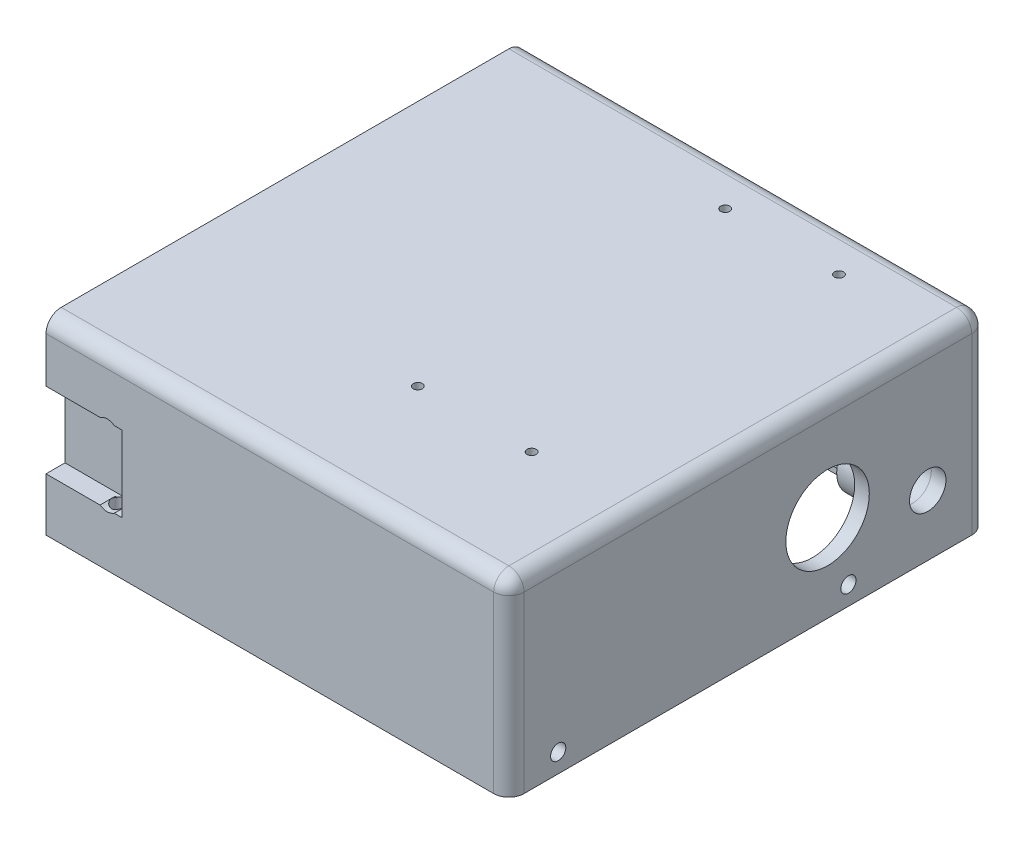
from build123d import *

# Parameters (mm, degrees)
SKETCH1_W                     = 63
SKETCH1_H                     = 63
BOSS_EXTRUDE2_DEPTH           = 25
SKETCH1_4_W                   = 59
SKETCH1_4_H                   = 55
CUT_EXTRUDE1_DEPTH            = 23
SKETCH4_W                     = 2
SKETCH4_H                     = 55
BOSS_EXTRUDE3_DEPTH           = 10
FILLET1_R                     = 2
SKETCH5_W                     = 2
SKETCH5_H                     = 63
CUT_EXTRUDE3_DEPTH            = 93.536479293
SKETCH6_W                     = 2.2
SKETCH6_H                     = 2.2
CUT_EXTRUDE4_DEPTH            = 59
SKETCH7_W                     = 10
SKETCH7_H                     = 10
CUT_EXTRUDE5_DEPTH            = 2.5
CUT_EXTRUDE6_DEPTH            = 11.5
CUT_EXTRUDE6_DEPTH_BACK       = 1.5
SKETCH8_R                     = 0.875
SKETCH9_W                     = 10
SKETCH9_H                     = 10
CUT_EXTRUDE7_DEPTH            = 2.5
CUT_EXTRUDE8_DEPTH            = 11.5
CUT_EXTRUDE8_DEPTH_BACK       = 1.5
SKETCH10_R                    = 0.875
CUT_EXTRUDE9_DEPTH            = 2
CUT_EXTRUDE10_DEPTH           = 2
FILLET2_R                     = 0.3
CUT_EXTRUDE12_REACH           = 94.536
CUT_EXTRUDE13_REACH           = 77.606
SKETCH15_W                    = 5
SKETCH15_H                    = 10
FILLET3_R                     = 1
SKETCH18_R                    = 2.4
CUT_EXTRUDE16_DEPTH           = 10
CUT_EXTRUDE16_DRAFT           = 2
SKETCH18_R_2                  = 5.5
CUT_EXTRUDE16_PROFILE_2_DEPTH = 10
CUT_EXTRUDE16_PROFILE_2_DRAFT = 2
SKETCH18_R_3                  = 1
CUT_EXTRUDE16_PROFILE_3_DEPTH = 10
CUT_EXTRUDE16_PROFILE_3_DRAFT = 2
CUT_EXTRUDE16_PROFILE_4_DEPTH = 10
CUT_EXTRUDE16_PROFILE_4_DRAFT = 2
SKETCH19_R                    = 2.469841539
BOSS_EXTRUDE4_DEPTH           = 6
SKETCH13_R                    = 0.6
CUT_EXTRUDE17_DEPTH           = 6


with BuildPart() as part:
    # Sketch1 → Boss-Extrude2 (new body)
    with BuildSketch(Plane(origin=(0, 0, 0), x_dir=(1, 0, 0), z_dir=(0, 1, 0))):
        with Locations((31.5, 31.5)):
            Rectangle(SKETCH1_W, SKETCH1_H)
    extrude(amount=BOSS_EXTRUDE2_DEPTH)

    # Sketch1<4> → Cut-Extrude1 (cut)
    with BuildSketch(Plane(origin=(0, 0, 0), x_dir=(1, 0, 0), z_dir=(0, 1, 0))):
        with Locations((31.5, 31.5)):
            Rectangle(SKETCH1_4_W, SKETCH1_4_H)
    extrude(amount=CUT_EXTRUDE1_DEPTH, mode=Mode.SUBTRACT)

    # Sketch4 → Boss-Extrude3 (add)
    with BuildSketch(Plane.XZ.offset(-23)):
        with Locations((30.5, -31.5)):
            Rectangle(SKETCH4_W, SKETCH4_H)
    extrude(amount=BOSS_EXTRUDE3_DEPTH)

    # Fillet1
    fillet1_edges = [part.edges().sort_by_distance(p)[0] for p in [
        (63, 25, -31.5),
        (31.5, 25, 0),
        (0, 25, -31.5),
        (0, 12.5, 0),
        (63, 12.5, 0),
        (63, 12.5, -63),
        (0, 12.5, -63),
        (31.5, 25, -63),
    ]]
    fillet(fillet1_edges, radius=FILLET1_R)

    # Sketch5 → Cut-Extrude3 (cut, through all)
    with BuildSketch(Plane(origin=(0, 0, 0), x_dir=(-1, 0, 0), z_dir=(0, -1, 0))):
        with Locations((-1, 31.5)):
            Rectangle(SKETCH5_W, SKETCH5_H)
    extrude(amount=-CUT_EXTRUDE3_DEPTH, mode=Mode.SUBTRACT)

    # Sketch6 → Cut-Extrude4 (cut)
    with BuildSketch(Plane.ZY.offset(-2)):
        with Locations((-2.9, 1.85)):
            Rectangle(SKETCH6_W, SKETCH6_H)
        with Locations((-60.1, 1.85)):
            Rectangle(SKETCH6_W, SKETCH6_H)
    extrude(amount=-CUT_EXTRUDE4_DEPTH, mode=Mode.SUBTRACT)

    # Sketch7 → Cut-Extrude5 (cut)
    with BuildSketch(Plane(origin=(0, 0, -63), x_dir=(-1, 0, 0), z_dir=(0, 0, -1))):
        with Locations((-7, 12)):
            Rectangle(SKETCH7_W, SKETCH7_H)
    extrude(amount=-CUT_EXTRUDE5_DEPTH, mode=Mode.SUBTRACT)

    # Sketch8 → Cut-Extrude6 (cut, two sides: drawn at the far end of the back side and taken through both)
    with BuildSketch(Plane(origin=(0, 7, 0), x_dir=(1, 0, 0), z_dir=(0, 1, 0)).offset(-CUT_EXTRUDE6_DEPTH_BACK)):
        with Locations(Location((10, 61.5, 0), (0, 0, 270))):
            Circle(SKETCH8_R)
    extrude(amount=CUT_EXTRUDE6_DEPTH + CUT_EXTRUDE6_DEPTH_BACK, mode=Mode.SUBTRACT)

    # Sketch9 → Cut-Extrude7 (cut)
    with BuildSketch(Plane.XY):
        with Locations((7, 12)):
            Rectangle(SKETCH9_W, SKETCH9_H)
    extrude(amount=-CUT_EXTRUDE7_DEPTH, mode=Mode.SUBTRACT)

    # Sketch10 → Cut-Extrude8 (cut, two sides: drawn at the far end of the back side and taken through both)
    with BuildSketch(Plane(origin=(0, 7, 0), x_dir=(1, 0, 0), z_dir=(0, 1, 0)).offset(-CUT_EXTRUDE8_DEPTH_BACK)):
        with Locations((10, 1.5)):
            Circle(SKETCH10_R)
    extrude(amount=CUT_EXTRUDE8_DEPTH + CUT_EXTRUDE8_DEPTH_BACK, mode=Mode.SUBTRACT)

    # Sketch11 → Cut-Extrude9 (cut)
    with BuildSketch(Plane(origin=(0, 0, -63), x_dir=(-1, 0, 0), z_dir=(0, 0, -1))):
        with BuildLine():
            Line((-9.122986176, 7), (-10.8, 7))
            add(Edge.make_bspline(
                [(-10.8, 7), (-9.980201359, 6.395551325), (-9.122986176, 7)],
                knots=[0, 0, 0, 1, 1, 1], degree=2))
        make_face()
        with BuildLine():
            Line((-9.122986176, 17), (-10.8, 17))
            add(Edge.make_bspline(
                [(-10.8, 17), (-9.980201359, 17.604448675), (-9.122986176, 17)],
                knots=[0, 0, 0, 1, 1, 1], degree=2))
        make_face()
    extrude(amount=-CUT_EXTRUDE9_DEPTH, mode=Mode.SUBTRACT)

    # Sketch12 → Cut-Extrude10 (cut)
    with BuildSketch(Plane.XY):
        with BuildLine():
            Line((11, 7), (9.120131213, 7))
            add(Edge.make_bspline(
                [(11, 7), (10.05659536, 6.399803182), (9.120131213, 7)],
                knots=[0, 0, 0, 1, 1, 1], degree=2))
        make_face()
        with BuildLine():
            Line((11, 17), (9.120131213, 17))
            add(Edge.make_bspline(
                [(11, 17), (10.05659536, 17.600196818), (9.120131213, 17)],
                knots=[0, 0, 0, 1, 1, 1], degree=2))
        make_face()
    extrude(amount=-CUT_EXTRUDE10_DEPTH, mode=Mode.SUBTRACT)

    # Fillet2
    fillet2_edges = [part.edges().sort_by_distance(p)[0] for p in [
        (31.5, 2.95, -59),
        (2, 0.75, -60.1),
        (2, 1.85, -61.2),
        (31.5, 0.75, -61.2),
        (31.5, 2.95, -61.2),
        (2, 2.95, -60.1),
        (2, 2.95, -2.9),
        (31.5, 2.95, -4),
        (31.5, 2.95, -1.8),
        (31.5, 0.75, -1.8),
        (2, 0.75, -2.9),
        (2, 1.85, -1.8),
    ]]
    fillet(fillet2_edges, radius=FILLET2_R)

    # Sketch14 → Cut-Extrude12 (cut, up to next)
    with BuildSketch(Plane(origin=(0, 0, -63), x_dir=(-1, 0, 0), z_dir=(0, 0, -1)), mode=Mode.PRIVATE) as cut_extrude12_sk1:
        with BuildLine():
            Line((-39, 14.7), (-45, 14.7))
            ThreePointArc((-45, 14.7), (-48.25, 17.95), (-45, 21.2))
            Line((-45, 21.2), (-39, 21.2))
            ThreePointArc((-39, 21.2), (-35.75, 17.95), (-39, 14.7))
        make_face()
    cut_extrude12_tool1 = extrude(cut_extrude12_sk1.sketch, amount=-CUT_EXTRUDE12_REACH, mode=Mode.PRIVATE) & part.part
    add(cut_extrude12_tool1.solids().sort_by_distance((42, 17.95, -63))[0], mode=Mode.SUBTRACT)

    # Sketch15 → Cut-Extrude13 (cut, up to next)
    with BuildSketch(Plane.ZY.offset(-29.5), mode=Mode.PRIVATE) as cut_extrude13_sk1:
        with Locations((-6.5, 18)):
            Rectangle(SKETCH15_W, SKETCH15_H)
    cut_extrude13_tool1 = extrude(cut_extrude13_sk1.sketch, amount=-CUT_EXTRUDE13_REACH, mode=Mode.PRIVATE) & part.part
    add(cut_extrude13_tool1.solids().sort_by_distance((29.5, 18, -6.5))[0], mode=Mode.SUBTRACT)

    # Fillet3
    fillet3_edges = [part.edges().sort_by_distance(p)[0] for p in [
        (29.5, 13, -34),
        (30.5, 13, -9),
        (29.5, 18, -59),
        (31.5, 18, -59),
        (30.5, 13, -59),
        (31.5, 13, -34),
    ]]
    fillet(fillet3_edges, radius=FILLET3_R - 0.0001)  # a hair under: the kernel refuses the full size


with BuildPart() as cut_extrude16_tool:
    # Sketch18 → Cut-Extrude16 (with draft: the straight prism first)
    with BuildSketch(Plane(origin=(63, 0, 0), x_dir=(0, 0, -1), z_dir=(1, 0, 0))):
        with Locations((55.2, 8)):
            Circle(SKETCH18_R)
    extrude(amount=-CUT_EXTRUDE16_DEPTH)
    # Cut-Extrude16: the draft: its side faces are tilted about the plane it starts from
    cut_extrude16_sides = [cut_extrude16_tool.faces().sort_by_distance(p)[0] for p in [
        (58, 8, -52.8),
    ]]
    draft(cut_extrude16_sides, Plane(origin=(63, 0, 0), x_dir=(0, 0, -1), z_dir=(1, 0, 0)), CUT_EXTRUDE16_DRAFT)


with BuildPart() as part_1:
    add(part.part)

    # Cut-Extrude16: cut by cut_extrude16_tool
    add(cut_extrude16_tool.part, mode=Mode.SUBTRACT)


with BuildPart() as cut_extrude16_profile_2_tool:
    # Sketch18 → Cut-Extrude16 profile 2 (with draft: the straight prism first)
    with BuildSketch(Plane(origin=(63, 0, 0), x_dir=(0, 0, -1), z_dir=(1, 0, 0))):
        with Locations((42, 11.5)):
            Circle(SKETCH18_R_2)
    extrude(amount=-CUT_EXTRUDE16_PROFILE_2_DEPTH)
    # Cut-Extrude16 profile 2: the draft: its side faces are tilted about the plane it starts from
    cut_extrude16_profile_2_sides = [cut_extrude16_profile_2_tool.faces().sort_by_distance(p)[0] for p in [
        (58, 11.5, -36.5),
    ]]
    draft(cut_extrude16_profile_2_sides, Plane(origin=(63, 0, 0), x_dir=(0, 0, -1), z_dir=(1, 0, 0)), CUT_EXTRUDE16_PROFILE_2_DRAFT)


with BuildPart() as part_2:
    add(part_1.part)

    # Cut-Extrude16 profile 2: cut by cut_extrude16_profile_2_tool
    add(cut_extrude16_profile_2_tool.part, mode=Mode.SUBTRACT)


with BuildPart() as cut_extrude16_profile_3_tool:
    # Sketch18 → Cut-Extrude16 profile 3 (with draft: the straight prism first)
    with BuildSketch(Plane(origin=(63, 0, 0), x_dir=(0, 0, -1), z_dir=(1, 0, 0))):
        with Locations((44.75, 2.5)):
            Circle(SKETCH18_R_3)
    extrude(amount=-CUT_EXTRUDE16_PROFILE_3_DEPTH)
    # Cut-Extrude16 profile 3: the draft: its side faces are tilted about the plane it starts from
    cut_extrude16_profile_3_sides = [cut_extrude16_profile_3_tool.faces().sort_by_distance(p)[0] for p in [
        (58, 2.5, -43.75),
    ]]
    draft(cut_extrude16_profile_3_sides, Plane(origin=(63, 0, 0), x_dir=(0, 0, -1), z_dir=(1, 0, 0)), CUT_EXTRUDE16_PROFILE_3_DRAFT)


with BuildPart() as part_3:
    add(part_2.part)

    # Cut-Extrude16 profile 3: cut by cut_extrude16_profile_3_tool
    add(cut_extrude16_profile_3_tool.part, mode=Mode.SUBTRACT)


with BuildPart() as cut_extrude16_profile_4_tool:
    # Sketch18 → Cut-Extrude16 profile 4 (with draft: the straight prism first)
    with BuildSketch(Plane(origin=(63, 0, 0), x_dir=(0, 0, -1), z_dir=(1, 0, 0))):
        with Locations((6.5, 2.5)):
            Circle(SKETCH18_R_3)
    extrude(amount=-CUT_EXTRUDE16_PROFILE_4_DEPTH)
    # Cut-Extrude16 profile 4: the draft: its side faces are tilted about the plane it starts from
    cut_extrude16_profile_4_sides = [cut_extrude16_profile_4_tool.faces().sort_by_distance(p)[0] for p in [
        (58, 2.5, -5.5),
    ]]
    draft(cut_extrude16_profile_4_sides, Plane(origin=(63, 0, 0), x_dir=(0, 0, -1), z_dir=(1, 0, 0)), CUT_EXTRUDE16_PROFILE_4_DRAFT)


with BuildPart() as part_4:
    add(part_3.part)

    # Cut-Extrude16 profile 4: cut by cut_extrude16_profile_4_tool
    add(cut_extrude16_profile_4_tool.part, mode=Mode.SUBTRACT)

    # Sketch19 → Boss-Extrude4 (add)
    with BuildSketch(Plane.ZY.offset(-61)):
        with BuildLine():
            ThreePointArc((-59, 6.7510004), (-54.567544468, 4.050316468), (-51.2, 8))
            ThreePointArc((-51.2, 8), (-54.567544468, 11.949683532), (-59, 9.2489996))
            Line((-59, 9.2489996), (-59, 6.7510004))
        make_face()
        with Locations((-55.2, 8)):
            Circle(SKETCH19_R, mode=Mode.SUBTRACT)
    extrude(amount=BOSS_EXTRUDE4_DEPTH)

    # Sketch13 → Cut-Extrude17 (cut)
    with BuildSketch(Plane(origin=(0, 23, 0), x_dir=(-1, 0, 0), z_dir=(0, -1, 0))):
        with Locations(Location((-34.5, 57, 0), (0, 0, 90))):
            Circle(SKETCH13_R)
        with Locations(Location((-49.5, 57, 0), (0, 0, 90))):
            Circle(SKETCH13_R)
        with Locations(Location((-49.5, 16.5, 0), (0, 0, 90))):
            Circle(SKETCH13_R)
        with Locations(Location((-34.5, 16.5, 0), (0, 0, 90))):
            Circle(SKETCH13_R)
    extrude(amount=-CUT_EXTRUDE17_DEPTH, mode=Mode.SUBTRACT)


solid = part_4.part
